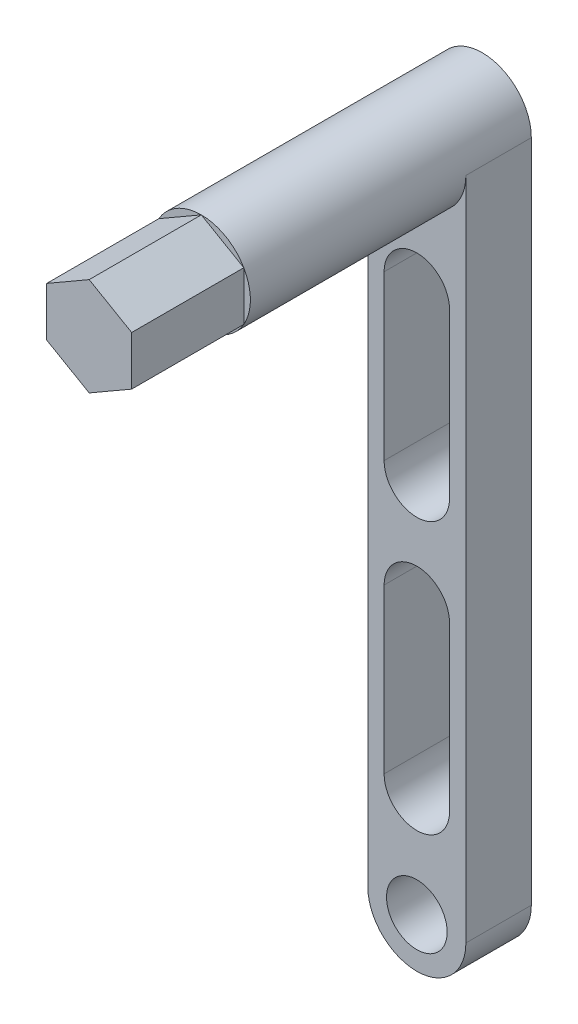
from build123d import *

# Parameters (mm, degrees)
SKETCH1_R           = 4.635
BOSS_EXTRUDE1_DEPTH = 10
BOSS_EXTRUDE2_DEPTH = 42.94
BOSS_EXTRUDE3_DEPTH = 17.14


with BuildPart() as part:
    # Sketch1 → Boss-Extrude1 (new body)
    with BuildSketch(Plane.XY):
        with BuildLine():
            Line((-7.5, 50.8), (-7.5, -50.8))
            ThreePointArc((-7.5, -50.8), (0, -58.3), (7.5, -50.8))
            Line((7.5, -50.8), (7.5, 50.8))
            ThreePointArc((7.5, 50.8), (0, 43.3), (-7.5, 50.8))
        make_face()
        with Locations((0, -50.8)):
            Circle(SKETCH1_R, mode=Mode.SUBTRACT)
        with BuildLine():
            ThreePointArc((5, -34.665), (0, -39.665), (-5, -34.665))
            Line((-5, -34.665), (-5, -9.665))
            ThreePointArc((-5, -9.665), (0, -4.665), (5, -9.665))
            Line((5, -9.665), (5, -34.665))
        make_face(mode=Mode.SUBTRACT)
        with BuildLine():
            ThreePointArc((-5, 31.8), (0, 36.8), (5, 31.8))
            Line((5, 31.8), (5, 6.8))
            ThreePointArc((5, 6.8), (0, 1.8), (-5, 6.8))
            Line((-5, 6.8), (-5, 31.8))
        make_face(mode=Mode.SUBTRACT)
    extrude(amount=BOSS_EXTRUDE1_DEPTH)

    # Sketch1<4> → Boss-Extrude2 (add)
    with BuildSketch(Plane.XY):
        with BuildLine():
            ThreePointArc((7.5, 50.8), (0, 58.3), (-7.5, 50.8))
            ThreePointArc((-7.5, 50.8), (0, 43.3), (7.5, 50.8))
        make_face()
    extrude(amount=BOSS_EXTRUDE2_DEPTH)

    # Sketch3 → Boss-Extrude3 (add)
    with BuildSketch(Plane.XY.offset(42.94)):
        Polygon((0, 43.3), (6.495190528, 47.05), (6.495190528, 54.55), (0, 58.3), (-6.495190528, 54.55), (-6.495190528, 47.05), align=None)
    extrude(amount=BOSS_EXTRUDE3_DEPTH)


solid = part.part
